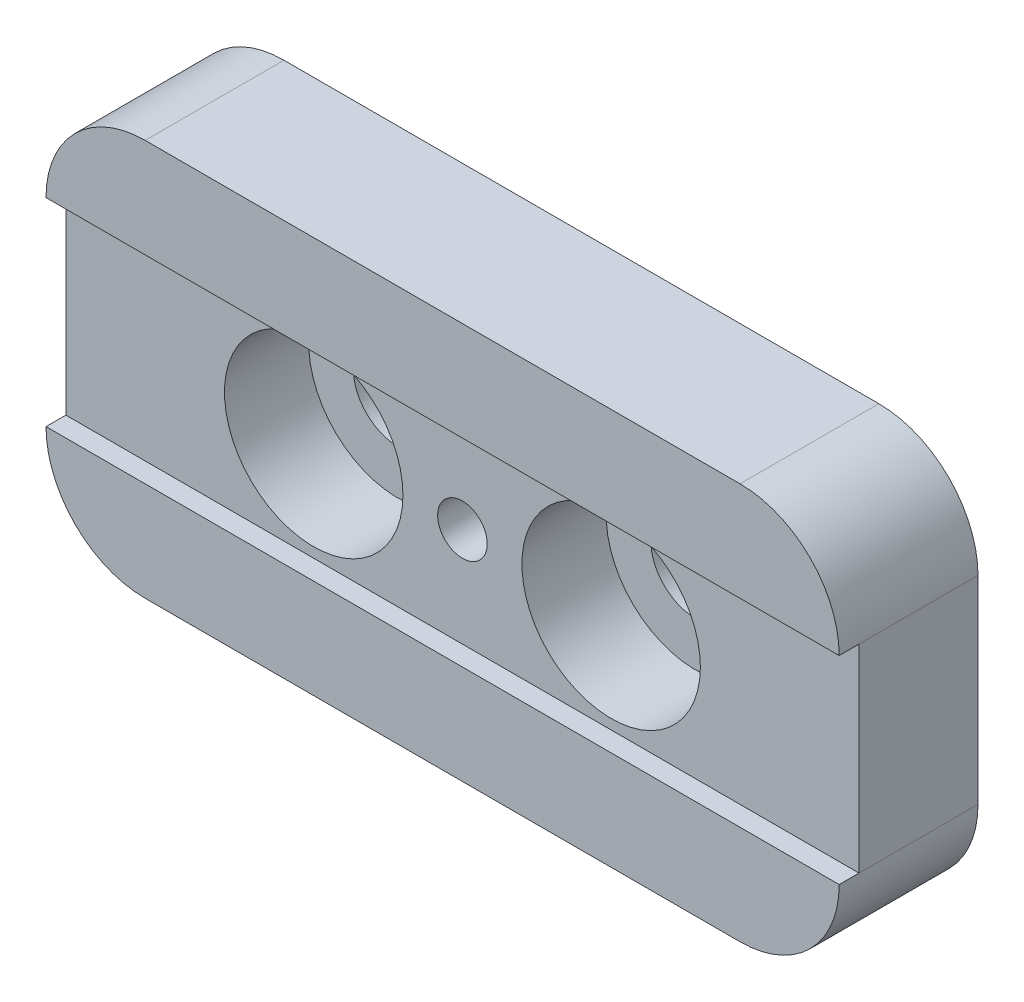
from build123d import *

# Parameters (mm, degrees)
SKETCH_1_W                   = 80
SKETCH_1_H                   = 40
EXTRUDE_1_DEPTH              = 14
SKETCH_2_W                   = 80
SKETCH_2_H                   = 20
CUT_EXTRUDE_1_DEPTH          = 2
HOLE_WIZARD_M6_1_D           = 5
HOLE_WIZARD_M6_1_DEPTH       = 15
HOLE_WIZARD_M6_1_TIP         = 1.502151548
HOLE_WIZARD_M8_1_D           = 9
HOLE_WIZARD_M8_1_CBORE_D     = 18
HOLE_WIZARD_M8_1_CBORE_DEPTH = 8.5
FILLET_1_R                   = 10


with BuildPart() as part:
    # 草图1 → 凸台-拉伸1 (new body)
    with BuildSketch(Plane.XY):
        Rectangle(SKETCH_1_W, SKETCH_1_H)
    extrude(amount=EXTRUDE_1_DEPTH)

    # 草图2 → 切除-拉伸1 (cut)
    with BuildSketch(Plane.XY.offset(14)):
        Rectangle(SKETCH_2_W, SKETCH_2_H)
    extrude(amount=-CUT_EXTRUDE_1_DEPTH, mode=Mode.SUBTRACT)

    # M6 螺纹孔1
    with Locations(Plane.XY.offset(12)):
        with Locations((0, 0)):
            Hole(HOLE_WIZARD_M6_1_D / 2, depth=HOLE_WIZARD_M6_1_DEPTH)
            with Locations((0, 0, -(HOLE_WIZARD_M6_1_DEPTH + HOLE_WIZARD_M6_1_TIP / 2))):  # 118° drill point
                Cone(0, HOLE_WIZARD_M6_1_D / 2, HOLE_WIZARD_M6_1_TIP, mode=Mode.SUBTRACT)

    # M8 六角头螺栓的柱形沉头孔1 (through all)
    with Locations(Plane.XY.offset(12)):
        with Locations((-15, 0), (15, 0)):
            CounterBoreHole(HOLE_WIZARD_M8_1_D / 2, HOLE_WIZARD_M8_1_CBORE_D / 2, HOLE_WIZARD_M8_1_CBORE_DEPTH)

    # 圆角1
    fillet_1_edges = [part.edges().sort_by_distance(p)[0] for p in [
        (-40, 20, 7),
        (40, 20, 7),
        (40, -20, 7),
        (-40, -20, 7),
    ]]
    fillet(fillet_1_edges, radius=FILLET_1_R - 0.0001)  # a hair under: the kernel refuses the full size


solid = part.part
